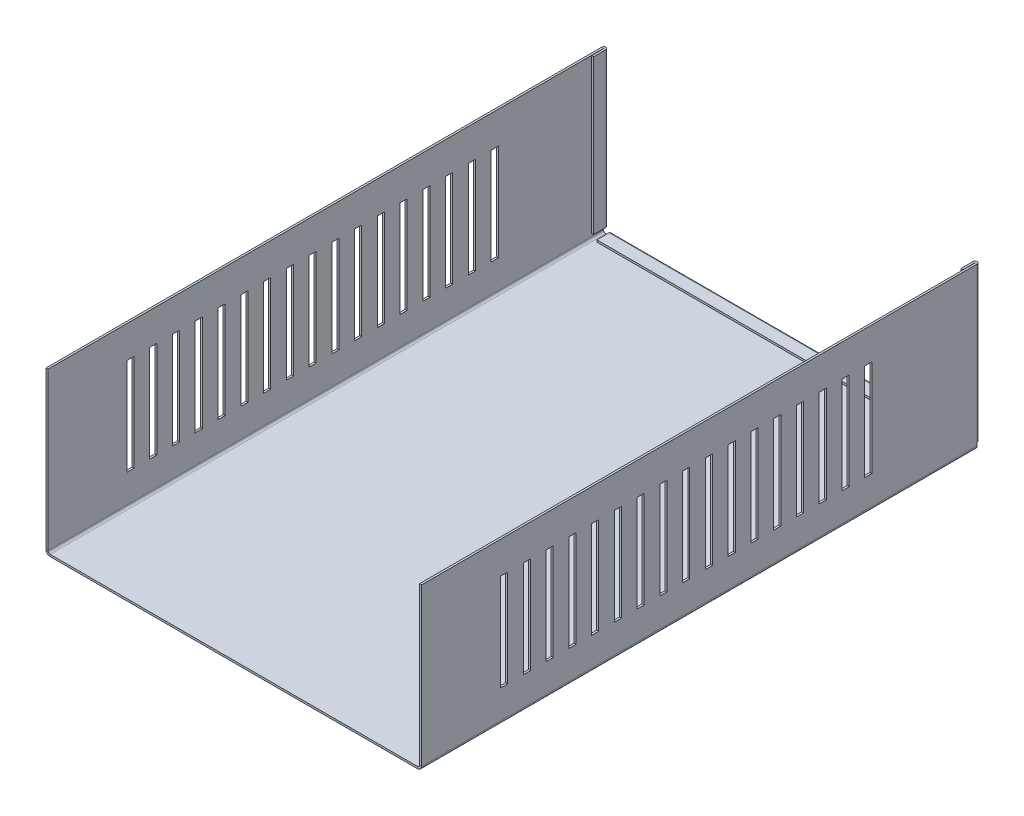
from build123d import *

# Parameters (mm, degrees)
SKETCH1_W                      = 132
SKETCH1_H                      = 196
BASE_FLANGE1_DEPTH             = 0.7
EDGE_FLANGE1_STRIP_W           = 4.2732
EDGE_FLANGE1_STRIP_H           = 0.7
EDGE_FLANGE1_STRIP_CUT_DEPTH   = 196
EDGE_FLANGE1_STRIP_2_W         = 4.2732
EDGE_FLANGE1_STRIP_2_H         = 0.7
EDGE_FLANGE1_STRIP_CUT_2_DEPTH = 196
EDGE_FLANGE1_DEPTH             = 196
EDGE_FLANGE1_BEND_DEPTH        = 196
HEM1_START                     = -2
HEM1_DEPTH                     = 3.9
HEM1_START_2                   = 1.9
HEM1_2_DEPTH                   = 54.1
HEM1_START_3                   = -0.626066
HEM1_3_DEPTH                   = 57.626066
HEM1_START_4                   = -63.4
HEM1_4_DEPTH                   = 126.8
HEM1_5_DEPTH                   = 126.8
SKETCH19_W                     = 2.5
SKETCH19_H                     = 34
CUT_EXTRUDE1_DEPTH             = 10
LPATTERN1_COUNT                = 17
LPATTERN1_PITCH                = 8
MIRROR1_COPY_1_SKETCH_W        = 2.5
MIRROR1_COPY_1_SKETCH_H        = 34
MIRROR1_COPY_1_DEPTH           = 10
MIRROR1_COPY_2_SKETCH_W        = 2.5
MIRROR1_COPY_2_SKETCH_H        = 34
MIRROR1_COPY_2_DEPTH           = 10
MIRROR1_COPY_3_SKETCH_W        = 2.5
MIRROR1_COPY_3_SKETCH_H        = 34
MIRROR1_COPY_3_DEPTH           = 10
MIRROR1_COPY_4_SKETCH_W        = 2.5
MIRROR1_COPY_4_SKETCH_H        = 34
MIRROR1_COPY_4_DEPTH           = 10
MIRROR1_COPY_5_SKETCH_W        = 2.5
MIRROR1_COPY_5_SKETCH_H        = 34
MIRROR1_COPY_5_DEPTH           = 10
MIRROR1_COPY_6_SKETCH_W        = 2.5
MIRROR1_COPY_6_SKETCH_H        = 34
MIRROR1_COPY_6_DEPTH           = 10
MIRROR1_COPY_7_SKETCH_W        = 2.5
MIRROR1_COPY_7_SKETCH_H        = 34
MIRROR1_COPY_7_DEPTH           = 10
MIRROR1_COPY_8_SKETCH_W        = 2.5
MIRROR1_COPY_8_SKETCH_H        = 34
MIRROR1_COPY_8_DEPTH           = 10
MIRROR1_COPY_9_SKETCH_W        = 2.5
MIRROR1_COPY_9_SKETCH_H        = 34
MIRROR1_COPY_9_DEPTH           = 10
MIRROR1_COPY_10_SKETCH_W       = 2.5
MIRROR1_COPY_10_SKETCH_H       = 34
MIRROR1_COPY_10_DEPTH          = 10
MIRROR1_COPY_11_SKETCH_W       = 2.5
MIRROR1_COPY_11_SKETCH_H       = 34
MIRROR1_COPY_11_DEPTH          = 10
MIRROR1_COPY_12_SKETCH_W       = 2.5
MIRROR1_COPY_12_SKETCH_H       = 34
MIRROR1_COPY_12_DEPTH          = 10
MIRROR1_COPY_13_SKETCH_W       = 2.5
MIRROR1_COPY_13_SKETCH_H       = 34
MIRROR1_COPY_13_DEPTH          = 10
MIRROR1_COPY_14_SKETCH_W       = 2.5
MIRROR1_COPY_14_SKETCH_H       = 34
MIRROR1_COPY_14_DEPTH          = 10
MIRROR1_COPY_15_SKETCH_W       = 2.5
MIRROR1_COPY_15_SKETCH_H       = 34
MIRROR1_COPY_15_DEPTH          = 10
MIRROR1_COPY_16_SKETCH_W       = 2.5
MIRROR1_COPY_16_SKETCH_H       = 34
MIRROR1_COPY_16_DEPTH          = 10


with BuildPart() as part:
    # Base-Flange1: sheet metal written as solids
    # Sketch1 → Base-Flange1 (new body)
    with BuildSketch(Plane(origin=(0, 0, 0), x_dir=(1, 0, 0), z_dir=(0, 1, 0))):
        Rectangle(SKETCH1_W, SKETCH1_H)
    extrude(amount=-BASE_FLANGE1_DEPTH)

    # Edge-Flange1: sheet metal written as solids
    # Edge-Flange1 strip (on a plane across the edge) → Edge-Flange1 strip cut (cut)
    with BuildSketch(Plane(origin=(-66, 0, -98), x_dir=(1, 0, 0), z_dir=(0, 0, 1))):
        with Locations((-0.7, -0.35)):
            Rectangle(EDGE_FLANGE1_STRIP_W, EDGE_FLANGE1_STRIP_H)
    extrude(amount=EDGE_FLANGE1_STRIP_CUT_DEPTH, mode=Mode.SUBTRACT)

    # Edge-Flange1 strip 2 (on a plane across the edge) → Edge-Flange1 strip cut 2 (cut)
    with BuildSketch(Plane(origin=(66, 0, 98), x_dir=(-1, 0, 0), z_dir=(0, 0, -1))):
        with Locations((-0.7, -0.35)):
            Rectangle(EDGE_FLANGE1_STRIP_2_W, EDGE_FLANGE1_STRIP_2_H)
    extrude(amount=EDGE_FLANGE1_STRIP_CUT_2_DEPTH, mode=Mode.SUBTRACT)

    # Edge-Flange1 section (on a plane across the edge) → Edge-Flange1 (add)
    with BuildSketch(Plane(origin=(-66, 0, -98), x_dir=(1, 0, 0), z_dir=(0, 0, 1))):
        with BuildLine():
            Line((0, 0.7366), (0, 56))
            Line((0, 56), (0.7, 56))
            Line((0.7, 56), (0.7, 0.7366))
            ThreePointArc((0.7, 0.7366), (0.915745145, 0.215745145), (1.4366, 0))
            Line((1.4366, 0), (1.4366, -0.7))
            ThreePointArc((1.4366, -0.7), (0.420770398, -0.279229602), (0, 0.7366))
        make_face()
    extrude(amount=EDGE_FLANGE1_DEPTH)

    # Edge-Flange1 section 2 (on a plane across the edge) → Edge-Flange1 bend (add)
    with BuildSketch(Plane(origin=(66, 0, 98), x_dir=(-1, 0, 0), z_dir=(0, 0, -1))):
        with BuildLine():
            Line((0, 0.7366), (0, 56))
            Line((0, 56), (0.7, 56))
            Line((0.7, 56), (0.7, 0.7366))
            ThreePointArc((0.7, 0.7366), (0.915745145, 0.215745145), (1.4366, 0))
            Line((1.4366, 0), (1.4366, -0.7))
            ThreePointArc((1.4366, -0.7), (0.420770398, -0.279229602), (0, 0.7366))
        make_face()
    extrude(amount=EDGE_FLANGE1_BEND_DEPTH)

    # Hem1: read off the stored shape, not the designer's step
    # Hem1 outline → Hem1 (cut)
    with BuildSketch(Plane(origin=(0, 0, 0), x_dir=(1, 0, 0), z_dir=(0, 1, 0)).offset(HEM1_START)):
        with BuildLine():
            Line((63.4, 98), (63.4, 97.25))
            Line((63.4, 97.25), (66, 97.25))
            ThreePointArc((66, 97.25), (65.780330086, 97.780330086), (65.25, 98))
            Line((65.25, 98), (63.4, 98))
        make_face()
        with BuildLine():
            Line((-63.4, 97.25), (-63.4, 98))
            Line((-63.4, 98), (-65.25, 98))
            ThreePointArc((-65.25, 98), (-65.780330086, 97.780330086), (-66, 97.25))
            Line((-66, 97.25), (-63.4, 97.25))
        make_face()
    extrude(amount=HEM1_DEPTH, mode=Mode.SUBTRACT)

    # Hem1 2 outline → Hem1 2 (add)
    with BuildSketch(Plane(origin=(0, 0, 0), x_dir=(1, 0, 0), z_dir=(0, 1, 0)).offset(HEM1_START_2)):
        with BuildLine():
            Line((64.5, 97.25), (64.5, 93))
            Line((64.5, 93), (65.2, 93))
            Line((65.2, 93), (65.2, 97.25))
            ThreePointArc((65.2, 97.25), (65.25, 97.3), (65.3, 97.25))
            Line((65.3, 97.25), (66, 97.25))
            ThreePointArc((66, 97.25), (65.25, 98), (64.5, 97.25))
        make_face()
        with BuildLine():
            Line((-64.5, 93), (-64.5, 97.25))
            ThreePointArc((-64.5, 97.25), (-65.25, 98), (-66, 97.25))
            Line((-66, 97.25), (-65.3, 97.25))
            ThreePointArc((-65.3, 97.25), (-65.25, 97.3), (-65.2, 97.25))
            Line((-65.2, 97.25), (-65.2, 93))
            Line((-65.2, 93), (-64.5, 93))
        make_face()
    extrude(amount=HEM1_2_DEPTH)

    # Hem1 3 outline → Hem1 3 (cut)
    with BuildSketch(Plane(origin=(0, 0, 0), x_dir=(1, 0, 0), z_dir=(0, 1, 0)).offset(HEM1_START_3)):
        with BuildLine():
            Line((-65.25, 98), (-66, 98))
            Line((-66, 98), (-66, 97.25))
            ThreePointArc((-66, 97.25), (-65.780330086, 97.780330086), (-65.25, 98))
        make_face()
        with BuildLine():
            ThreePointArc((65.25, 98), (65.780330086, 97.780330086), (66, 97.25))
            Line((66, 97.25), (66, 98))
            Line((66, 98), (65.25, 98))
        make_face()
    extrude(amount=HEM1_3_DEPTH, mode=Mode.SUBTRACT)

    # Hem1 4 outline → Hem1 4 (cut)
    with BuildSketch(Plane.YZ.offset(HEM1_START_4)):
        with BuildLine():
            Line((0, -98), (0, -97.998331477))
            ThreePointArc((0, -97.998331477), (-0.497722558, -97.762347538), (-0.7, -97.25))
            Line((-0.7, -97.25), (-0.7, -98))
            Line((-0.7, -98), (0, -98))
        make_face()
    extrude(amount=HEM1_4_DEPTH, mode=Mode.SUBTRACT)

    # Hem1 5 outline → Hem1 5 (add)
    with BuildSketch(Plane.YZ.offset(HEM1_START_4)):
        with BuildLine():
            Line((0.8, -93), (0.1, -93))
            Line((0.1, -93), (0.1, -97.25))
            ThreePointArc((0.1, -97.25), (0.05, -97.3), (0, -97.25))
            Line((0, -97.25), (0, -97.998331477))
            ThreePointArc((0, -97.998331477), (0.562347538, -97.797722558), (0.8, -97.25))
            Line((0.8, -97.25), (0.8, -93))
        make_face()
    extrude(amount=HEM1_5_DEPTH)

    # Sketch19 → Cut-Extrude1 (cut)
    with BuildSketch(Plane.ZY.offset(66)):
        with Locations((-59, 27.7366)):
            Rectangle(SKETCH19_W, SKETCH19_H)
    cut_extrude1 = extrude(amount=-CUT_EXTRUDE1_DEPTH, mode=Mode.SUBTRACT)

    # LPattern1: Cut-Extrude1 ×17
    with Locations(*[(0, 0, i * LPATTERN1_PITCH) for i in range(1, LPATTERN1_COUNT)]):
        add(cut_extrude1, mode=Mode.SUBTRACT)

    # Mirror1: Cut-Extrude1 across plane
    add(cut_extrude1.mirror(Plane.ZY), mode=Mode.SUBTRACT)

    # Mirror1 copy 1 sketch → Mirror1 copy 1 (cut)
    with BuildSketch(Plane(origin=(66, 0, 8), x_dir=(0, 0, 1), z_dir=(1, 0, 0))):
        with Locations((-59, -27.7366)):
            Rectangle(MIRROR1_COPY_1_SKETCH_W, MIRROR1_COPY_1_SKETCH_H)
    extrude(amount=-MIRROR1_COPY_1_DEPTH, mode=Mode.SUBTRACT)

    # Mirror1 copy 2 sketch → Mirror1 copy 2 (cut)
    with BuildSketch(Plane(origin=(66, 0, 16), x_dir=(0, 0, 1), z_dir=(1, 0, 0))):
        with Locations((-59, -27.7366)):
            Rectangle(MIRROR1_COPY_2_SKETCH_W, MIRROR1_COPY_2_SKETCH_H)
    extrude(amount=-MIRROR1_COPY_2_DEPTH, mode=Mode.SUBTRACT)

    # Mirror1 copy 3 sketch → Mirror1 copy 3 (cut)
    with BuildSketch(Plane(origin=(66, 0, 24), x_dir=(0, 0, 1), z_dir=(1, 0, 0))):
        with Locations((-59, -27.7366)):
            Rectangle(MIRROR1_COPY_3_SKETCH_W, MIRROR1_COPY_3_SKETCH_H)
    extrude(amount=-MIRROR1_COPY_3_DEPTH, mode=Mode.SUBTRACT)

    # Mirror1 copy 4 sketch → Mirror1 copy 4 (cut)
    with BuildSketch(Plane(origin=(66, 0, 32), x_dir=(0, 0, 1), z_dir=(1, 0, 0))):
        with Locations((-59, -27.7366)):
            Rectangle(MIRROR1_COPY_4_SKETCH_W, MIRROR1_COPY_4_SKETCH_H)
    extrude(amount=-MIRROR1_COPY_4_DEPTH, mode=Mode.SUBTRACT)

    # Mirror1 copy 5 sketch → Mirror1 copy 5 (cut)
    with BuildSketch(Plane(origin=(66, 0, 40), x_dir=(0, 0, 1), z_dir=(1, 0, 0))):
        with Locations((-59, -27.7366)):
            Rectangle(MIRROR1_COPY_5_SKETCH_W, MIRROR1_COPY_5_SKETCH_H)
    extrude(amount=-MIRROR1_COPY_5_DEPTH, mode=Mode.SUBTRACT)

    # Mirror1 copy 6 sketch → Mirror1 copy 6 (cut)
    with BuildSketch(Plane(origin=(66, 0, 48), x_dir=(0, 0, 1), z_dir=(1, 0, 0))):
        with Locations((-59, -27.7366)):
            Rectangle(MIRROR1_COPY_6_SKETCH_W, MIRROR1_COPY_6_SKETCH_H)
    extrude(amount=-MIRROR1_COPY_6_DEPTH, mode=Mode.SUBTRACT)

    # Mirror1 copy 7 sketch → Mirror1 copy 7 (cut)
    with BuildSketch(Plane(origin=(66, 0, 56), x_dir=(0, 0, 1), z_dir=(1, 0, 0))):
        with Locations((-59, -27.7366)):
            Rectangle(MIRROR1_COPY_7_SKETCH_W, MIRROR1_COPY_7_SKETCH_H)
    extrude(amount=-MIRROR1_COPY_7_DEPTH, mode=Mode.SUBTRACT)

    # Mirror1 copy 8 sketch → Mirror1 copy 8 (cut)
    with BuildSketch(Plane(origin=(66, 0, 64), x_dir=(0, 0, 1), z_dir=(1, 0, 0))):
        with Locations((-59, -27.7366)):
            Rectangle(MIRROR1_COPY_8_SKETCH_W, MIRROR1_COPY_8_SKETCH_H)
    extrude(amount=-MIRROR1_COPY_8_DEPTH, mode=Mode.SUBTRACT)

    # Mirror1 copy 9 sketch → Mirror1 copy 9 (cut)
    with BuildSketch(Plane(origin=(66, 0, 72), x_dir=(0, 0, 1), z_dir=(1, 0, 0))):
        with Locations((-59, -27.7366)):
            Rectangle(MIRROR1_COPY_9_SKETCH_W, MIRROR1_COPY_9_SKETCH_H)
    extrude(amount=-MIRROR1_COPY_9_DEPTH, mode=Mode.SUBTRACT)

    # Mirror1 copy 10 sketch → Mirror1 copy 10 (cut)
    with BuildSketch(Plane(origin=(66, 0, 80), x_dir=(0, 0, 1), z_dir=(1, 0, 0))):
        with Locations((-59, -27.7366)):
            Rectangle(MIRROR1_COPY_10_SKETCH_W, MIRROR1_COPY_10_SKETCH_H)
    extrude(amount=-MIRROR1_COPY_10_DEPTH, mode=Mode.SUBTRACT)

    # Mirror1 copy 11 sketch → Mirror1 copy 11 (cut)
    with BuildSketch(Plane(origin=(66, 0, 88), x_dir=(0, 0, 1), z_dir=(1, 0, 0))):
        with Locations((-59, -27.7366)):
            Rectangle(MIRROR1_COPY_11_SKETCH_W, MIRROR1_COPY_11_SKETCH_H)
    extrude(amount=-MIRROR1_COPY_11_DEPTH, mode=Mode.SUBTRACT)

    # Mirror1 copy 12 sketch → Mirror1 copy 12 (cut)
    with BuildSketch(Plane(origin=(66, 0, 96), x_dir=(0, 0, 1), z_dir=(1, 0, 0))):
        with Locations((-59, -27.7366)):
            Rectangle(MIRROR1_COPY_12_SKETCH_W, MIRROR1_COPY_12_SKETCH_H)
    extrude(amount=-MIRROR1_COPY_12_DEPTH, mode=Mode.SUBTRACT)

    # Mirror1 copy 13 sketch → Mirror1 copy 13 (cut)
    with BuildSketch(Plane(origin=(66, 0, 104), x_dir=(0, 0, 1), z_dir=(1, 0, 0))):
        with Locations((-59, -27.7366)):
            Rectangle(MIRROR1_COPY_13_SKETCH_W, MIRROR1_COPY_13_SKETCH_H)
    extrude(amount=-MIRROR1_COPY_13_DEPTH, mode=Mode.SUBTRACT)

    # Mirror1 copy 14 sketch → Mirror1 copy 14 (cut)
    with BuildSketch(Plane(origin=(66, 0, 112), x_dir=(0, 0, 1), z_dir=(1, 0, 0))):
        with Locations((-59, -27.7366)):
            Rectangle(MIRROR1_COPY_14_SKETCH_W, MIRROR1_COPY_14_SKETCH_H)
    extrude(amount=-MIRROR1_COPY_14_DEPTH, mode=Mode.SUBTRACT)

    # Mirror1 copy 15 sketch → Mirror1 copy 15 (cut)
    with BuildSketch(Plane(origin=(66, 0, 120), x_dir=(0, 0, 1), z_dir=(1, 0, 0))):
        with Locations((-59, -27.7366)):
            Rectangle(MIRROR1_COPY_15_SKETCH_W, MIRROR1_COPY_15_SKETCH_H)
    extrude(amount=-MIRROR1_COPY_15_DEPTH, mode=Mode.SUBTRACT)

    # Mirror1 copy 16 sketch → Mirror1 copy 16 (cut)
    with BuildSketch(Plane(origin=(66, 0, 128), x_dir=(0, 0, 1), z_dir=(1, 0, 0))):
        with Locations((-59, -27.7366)):
            Rectangle(MIRROR1_COPY_16_SKETCH_W, MIRROR1_COPY_16_SKETCH_H)
    extrude(amount=-MIRROR1_COPY_16_DEPTH, mode=Mode.SUBTRACT)


solid = part.part
